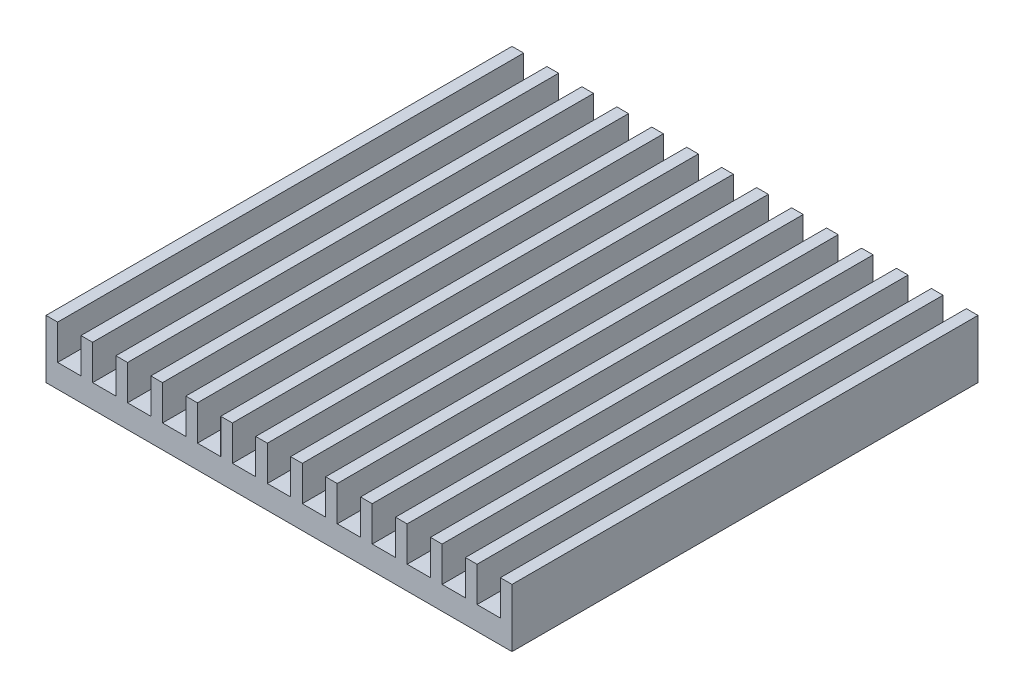
from build123d import *

# Parameters (mm, degrees)
SKETCH_1_W      = 40
SKETCH_1_H      = 40
EXTRUDE_1_DEPTH = 2
SKETCH_2_W      = 1
SKETCH_2_H      = 40
EXTRUDE_2_DEPTH = 3


with BuildPart() as part:
    # 草图1 → 凸台-拉伸1 (new body)
    with BuildSketch(Plane(origin=(0, 0, 0), x_dir=(1, 0, 0), z_dir=(0, 1, 0))):
        Rectangle(SKETCH_1_W, SKETCH_1_H)
    extrude(amount=EXTRUDE_1_DEPTH)

    # 草图2 → 凸台-拉伸2 (add)
    with BuildSketch(Plane(origin=(0, 2, 0), x_dir=(1, 0, 0), z_dir=(0, 1, 0))):
        with Locations((-19.5, 0)):
            Rectangle(SKETCH_2_W, SKETCH_2_H)
        with Locations((-16.5, 0)):
            Rectangle(SKETCH_2_W, SKETCH_2_H)
        with Locations((-13.5, 0)):
            Rectangle(SKETCH_2_W, SKETCH_2_H)
        with Locations((-10.5, 0)):
            Rectangle(SKETCH_2_W, SKETCH_2_H)
        with Locations((-7.5, 0)):
            Rectangle(SKETCH_2_W, SKETCH_2_H)
        with Locations((-4.5, 0)):
            Rectangle(SKETCH_2_W, SKETCH_2_H)
        with Locations((-1.5, 0)):
            Rectangle(SKETCH_2_W, SKETCH_2_H)
        with Locations((1.5, 0)):
            Rectangle(SKETCH_2_W, SKETCH_2_H)
        with Locations((4.5, 0)):
            Rectangle(SKETCH_2_W, SKETCH_2_H)
        with Locations((7.5, 0)):
            Rectangle(SKETCH_2_W, SKETCH_2_H)
        with Locations((10.5, 0)):
            Rectangle(SKETCH_2_W, SKETCH_2_H)
        with Locations((13.5, 0)):
            Rectangle(SKETCH_2_W, SKETCH_2_H)
        with Locations((16.5, 0)):
            Rectangle(SKETCH_2_W, SKETCH_2_H)
        with Locations((19.5, 0)):
            Rectangle(SKETCH_2_W, SKETCH_2_H)
    extrude(amount=EXTRUDE_2_DEPTH)


solid = part.part
